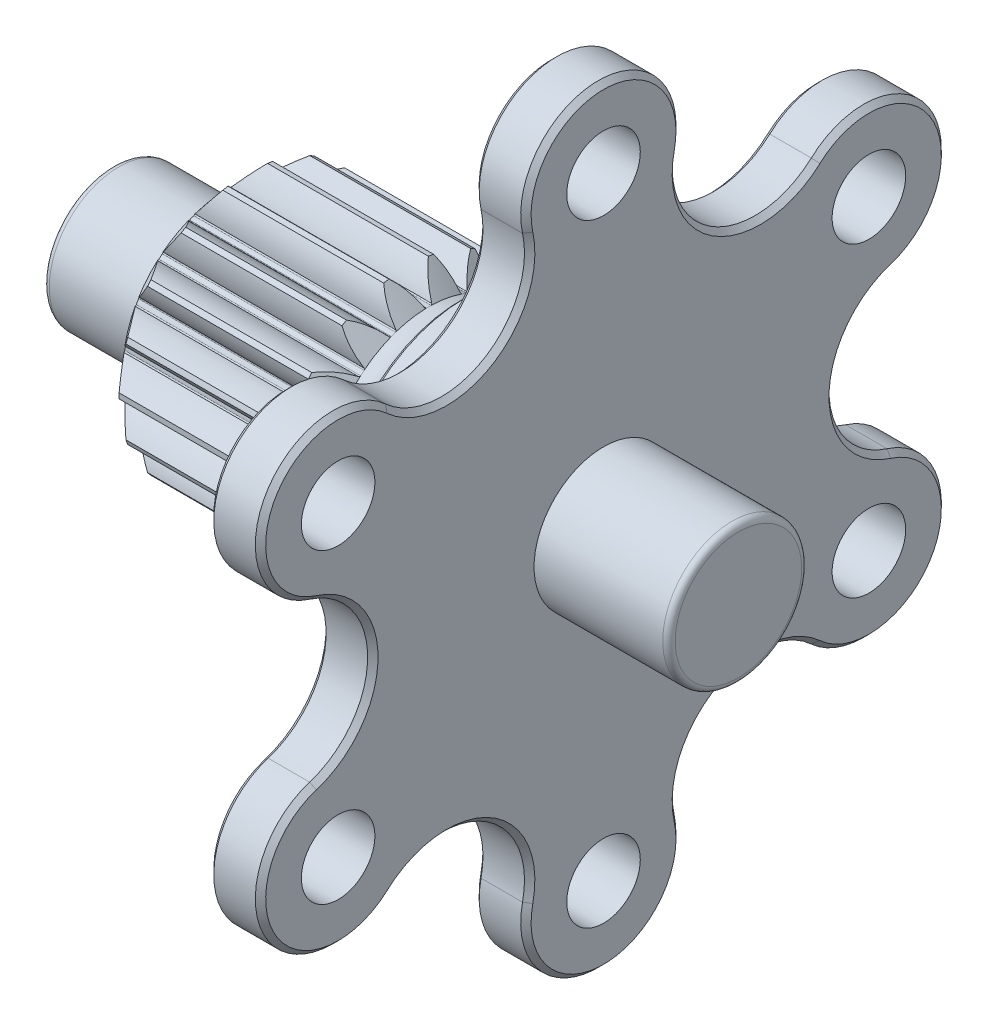
from build123d import *
from OCP.BRepFilletAPI import BRepFilletAPI_MakeChamfer

# Parameters (mm, degrees)
SKETCH1_R              = 47
BASE_EXTRUDE_DEPTH     = 6.35
M8_CLEARANCE_HOLES_D   = 9
CIRPATTERN_COUNT       = 6
CUT_EXTRUDE_DEPTH      = 67.770670957
CUT_EXTRUDE_DEPTH_BACK = 67.770670957
CHAMFER1_SIZE          = 0.635
SKETCH8_R              = 15.748
SHAFT_EXTRUDE_DEPTH    = 52.5820005
CHAMFER3_SIZE          = 0.635
SHAFT_CHAMFER_SIZE     = 1
CUT_EXTRUDE1_START     = -12.856999432
SKETCH45_R             = 15.748
SKETCH45_R_2           = 8.5127
CUT_EXTRUDE1_DEPTH     = 12.856999432
SKETCH55_R             = 8.5
BOSS_EXTRUDE4_DEPTH    = 16.51
SKETCH56_R             = 8.5127
BOSS_EXTRUDE5_DEPTH    = 1.143
FILLET9_R              = 1.524
CUT_EXTRUDE17_START    = -25.4
CUT_EXTRUDE17_DEPTH    = 25.4
CHAMFER6_SIZE          = 2.54
CHAMFER6_SIZE2         = 3.027054125
FILLET10_R             = 1.27
FILLET11_R             = 0.762
FILLET12_R             = 0.762
CHAMFER7_SIZE          = 0.508


with BuildPart() as part:
    # Sketch1 → Base-Extrude (new body)
    with BuildSketch(Plane(origin=(0, 0, 0), x_dir=(0, 0, -1), z_dir=(1, 0, 0))):
        Circle(SKETCH1_R)
    extrude(amount=-BASE_EXTRUDE_DEPTH)

    # M8 Clearance Holes (through all)
    with Locations(Plane(origin=(0, 0, 0), x_dir=(0, 0, -1), z_dir=(1, 0, 0))):
        with Locations((0, -37.5)):
            m8_clearance_holes = Hole(M8_CLEARANCE_HOLES_D / 2)

    # CirPattern: M8 Clearance Holes ×6 about axis
    cirpattern_axis = Axis((0, 0, 0), (1, 0, 0))
    for i in range(1, CIRPATTERN_COUNT):
        add(m8_clearance_holes.rotate(cirpattern_axis, i * 360 / CIRPATTERN_COUNT), mode=Mode.SUBTRACT)

    # Sketch19 → Cut-Extrude (cut, two sides: drawn at the far end of the back side and taken through both)
    with BuildSketch(Plane(origin=(0, 0, 0), x_dir=(0, 0, -1), z_dir=(1, 0, 0)).offset(-CUT_EXTRUDE_DEPTH_BACK)):
        with BuildLine():
            ThreePointArc((9.274838239, 35.443941724), (14.114033661, 24.446223401), (26.057934823, 25.754216393))
            ThreePointArc((26.057934823, 25.754216393), (33.921184851, 28.139425108), (40.703194264, 23.499999504))
            ThreePointArc((40.703194264, 23.499999504), (23.500000227, 40.703193847), (-4.7e-08, 47))
            ThreePointArc((-4.7e-08, 47), (7.40886473, 43.446320157), (9.274838239, 35.443941724))
        make_face()
        with BuildLine():
            ThreePointArc((-26.057934823, 25.754216393), (-14.114033661, 24.446223401), (-9.274838239, 35.443941724))
            ThreePointArc((-9.274838239, 35.443941724), (-7.40886476, 43.44632012), (-4.7e-08, 47))
            ThreePointArc((-4.7e-08, 47), (-23.500000787, 40.703193523), (-40.703194863, 23.499998466))
            ThreePointArc((-40.703194863, 23.499998466), (-33.921185443, 28.139425017), (-26.057934823, 25.754216393))
        make_face()
        with BuildLine():
            ThreePointArc((40.703193464, -23.50000089), (47, -8e-07), (40.703194264, 23.499999504))
            ThreePointArc((40.703194264, 23.499999504), (41.33004921, 15.30689472), (35.332773062, 9.689725331))
            ThreePointArc((35.332773062, 9.689725331), (28.228067323, 0), (35.332773062, -9.689725331))
            ThreePointArc((35.332773062, -9.689725331), (41.330049499, -15.306895465), (40.703193464, -23.50000089))
        make_face()
        with BuildLine():
            ThreePointArc((-35.332773062, 9.689725331), (-41.330048992, 15.306894161), (-40.703194863, 23.499998466))
            ThreePointArc((-40.703194863, 23.499998466), (-47, -6.9e-08), (-40.703194794, -23.499998586))
            ThreePointArc((-40.703194794, -23.499998586), (-41.330049018, -15.306894226), (-35.332773062, -9.689725331))
            ThreePointArc((-35.332773062, -9.689725331), (-28.228067323, 0), (-35.332773062, 9.689725331))
        make_face()
        with BuildLine():
            ThreePointArc((-26.057934823, -25.754216393), (-33.921185375, -28.139425028), (-40.703194794, -23.499998586))
            ThreePointArc((-40.703194794, -23.499998586), (-23.500000688, -40.703193581), (4.4e-08, -47))
            ThreePointArc((4.4e-08, -47), (-7.408864732, -43.446320155), (-9.274838239, -35.443941724))
            ThreePointArc((-9.274838239, -35.443941724), (-14.114033661, -24.446223401), (-26.057934823, -25.754216393))
        make_face()
        with BuildLine():
            ThreePointArc((4.4e-08, -47), (23.499999574, -40.703194224), (40.703193464, -23.50000089))
            ThreePointArc((40.703193464, -23.50000089), (33.92118406, -28.13942523), (26.057934823, -25.754216393))
            ThreePointArc((26.057934823, -25.754216393), (14.114033661, -24.446223401), (9.274838239, -35.443941724))
            ThreePointArc((9.274838239, -35.443941724), (7.408864759, -43.446320121), (4.4e-08, -47))
        make_face()
    extrude(amount=CUT_EXTRUDE_DEPTH + CUT_EXTRUDE_DEPTH_BACK, mode=Mode.SUBTRACT)

    # Chamfer1
    chamfer1_edges = [part.edges().sort_by_distance(p)[0] for p in [
        (-6.35, -24.446223401, 14.114033661),
        (-6.35, 24.446223401, -14.114033661),
        (-6.35, 24.446223401, 14.114033661),
        (-6.35, 23.5, 40.703193978),
        (-6.35, 47, 0),
        (-6.35, -24.446223401, -14.114033661),
        (-6.35, -23.5, -40.703193978),
        (-6.35, -47, 0),
        (-6.35, 0, 28.228067323),
        (-6.35, -23.5, 40.703193978),
        (-6.35, 0, -28.228067323),
        (-6.35, 23.5, -40.703193978),
    ]]
    chamfer(chamfer1_edges, length=CHAMFER1_SIZE)

    # Sketch8 → Shaft-Extrude (add)
    with BuildSketch(Plane.ZY.offset(6.35)):
        with Locations(Location((0, 0, 0), (0, 0, 180))):
            Circle(SKETCH8_R)
    extrude(amount=SHAFT_EXTRUDE_DEPTH)

    # Chamfer3
    chamfer3_edges = [part.edges().sort_by_distance(p)[0] for p in [
        (0, 24.446223401, -14.114033661),
        (0, -24.446223401, 14.114033661),
        (0, -24.446223401, -14.114033661),
        (0, -47, 0),
        (0, -23.5, -40.703193978),
        (0, 24.446223401, 14.114033661),
        (0, 47, 0),
        (0, 23.5, 40.703193978),
        (0, 0, -28.228067323),
        (0, 23.5, -40.703193978),
        (0, 0, 28.228067323),
        (0, -23.5, 40.703193978),
    ]]
    chamfer(chamfer3_edges, length=CHAMFER3_SIZE)

    # Shaft Chamfer
    shaft_chamfer_edges = [part.edges().sort_by_distance(p)[0] for p in [
        (-58.9320005, 0, 15.748),
    ]]
    chamfer(shaft_chamfer_edges, length=SHAFT_CHAMFER_SIZE)

    # Sketch45 → Cut-Extrude1 (cut)
    with BuildSketch(Plane.ZY.offset(58.9320005).offset(CUT_EXTRUDE1_START)):
        with Locations(Location((0, 0, 0), (0, 0, 180))):
            Circle(SKETCH45_R)
        Circle(SKETCH45_R_2, mode=Mode.SUBTRACT)
    extrude(amount=CUT_EXTRUDE1_DEPTH, mode=Mode.SUBTRACT)

    # Sketch55 → Boss-Extrude4 (add)
    with BuildSketch(Plane(origin=(0, 0, 0), x_dir=(0, 0, -1), z_dir=(1, 0, 0))):
        Circle(SKETCH55_R)
    extrude(amount=BOSS_EXTRUDE4_DEPTH)

    # Sketch56 → Boss-Extrude5 (add)
    with BuildSketch(Plane.ZY.offset(58.9320005)):
        Circle(SKETCH56_R)
    extrude(amount=BOSS_EXTRUDE5_DEPTH)

    # Fillet9
    fillet9_edges = [part.edges().sort_by_distance(p)[0] for p in [
        (-46.075001068, 0, -8.5127),
    ]]
    fillet(fillet9_edges, radius=FILLET9_R)

    # Cut-Extrude17: read off the stored shape, not the designer's step
    # Cut-Extrude17 outline → Cut-Extrude17 (cut)
    with BuildSketch(Plane.ZY.offset(46.075001068).offset(CUT_EXTRUDE17_START)):
        with BuildLine():
            ThreePointArc((-14.684667578, 5.688588763), (-12.987779277, 6.048943991), (-11.254165829, 5.986733001))
            ThreePointArc((-11.254165829, 5.986733001), (-11.162537651, 6.019355375), (-11.090657474, 6.084877757))
            ThreePointArc((-11.090657474, 6.084877757), (-10.95542401, 6.325117018), (-10.814987438, 6.562352263))
            ThreePointArc((-10.814987438, 6.562352263), (-10.794183479, 6.657363514), (-10.811745764, 6.753027031))
            ThreePointArc((-10.811745764, 6.753027031), (-11.732428783, 8.223274824), (-12.268796147, 9.873000815))
            ThreePointArc((-12.268796147, 9.873000815), (-13.63816805, 7.874000015), (-14.684667578, 5.688588763))
        make_face()
        with BuildLine():
            ThreePointArc((-12.469388985, 2.647934833), (-13.837402385, 3.714623697), (-14.905662359, 5.081410594))
            ThreePointArc((-14.905662359, 5.081410594), (-15.508752491, 2.73461152), (-15.744685706, 0.323072774))
            ThreePointArc((-15.744685706, 0.323072774), (-14.273381038, 1.242065902), (-12.623039862, 1.776537414))
            ThreePointArc((-12.623039862, 1.776537414), (-12.548095048, 1.8385311), (-12.50295975, 1.924686467))
            ThreePointArc((-12.50295975, 1.924686467), (-12.458048528, 2.196690097), (-12.407220551, 2.467650443))
            ThreePointArc((-12.407220551, 2.467650443), (-12.420166986, 2.564047187), (-12.469388985, 2.647934833))
        make_face()
        with BuildLine():
            ThreePointArc((-8.152132052, 13.473761428), (-10.122619264, 12.063667902), (-11.853461818, 10.367976993))
            ThreePointArc((-11.853461818, 10.367976993), (-10.135659657, 10.126230162), (-8.527873304, 9.474840233))
            ThreePointArc((-8.527873304, 9.474840233), (-8.430613472, 9.474156555), (-8.340658225, 9.511142985))
            ThreePointArc((-8.340658225, 9.511142985), (-8.13141367, 9.690641477), (-7.918307228, 9.865537551))
            ThreePointArc((-7.918307228, 9.865537551), (-7.86626214, 9.947703548), (-7.850046439, 10.043604504))
            ThreePointArc((-7.850046439, 10.043604504), (-8.212351117, 11.740077645), (-8.152132052, 13.473761428))
        make_face()
        with BuildLine():
            ThreePointArc((-12.623039866, -1.776537385), (-14.273381041, -1.24206587), (-15.744685707, -0.323072738))
            ThreePointArc((-15.744685707, -0.323072738), (-15.508752498, -2.734611484), (-14.905662371, -5.08141056))
            ThreePointArc((-14.905662371, -5.08141056), (-13.837402393, -3.714623666), (-12.469388991, -2.647934805))
            ThreePointArc((-12.469388991, -2.647934805), (-12.420166992, -2.564047159), (-12.407220557, -2.467650415))
            ThreePointArc((-12.407220557, -2.467650415), (-12.458048533, -2.196690069), (-12.502959755, -1.924686439))
            ThreePointArc((-12.502959755, -1.924686439), (-12.548095052, -1.838531072), (-12.623039866, -1.776537385))
        make_face()
        with BuildLine():
            ThreePointArc((-3.052200518, 15.449387561), (-5.3861332, 14.798279398), (-7.592553624, 13.796834183))
            ThreePointArc((-7.592553624, 13.796834183), (-6.061029895, 12.982143528), (-4.7729934, 11.8201419))
            ThreePointArc((-4.7729934, 11.8201419), (-4.681832885, 11.786234631), (-4.5846525, 11.790224))
            ThreePointArc((-4.5846525, 11.790224), (-4.326634836, 11.887331556), (-4.066562304, 11.978793409))
            ThreePointArc((-4.066562304, 11.978793409), (-3.989553493, 12.038203723), (-3.941515659, 12.122775047))
            ThreePointArc((-3.941515659, 12.122775047), (-3.701742705, 13.840853836), (-3.052200518, 15.449387561))
        make_face()
        with BuildLine():
            ThreePointArc((-11.254165843, -5.986732975), (-12.987779291, -6.048943962), (-14.684667591, -5.68858873))
            ThreePointArc((-14.684667591, -5.68858873), (-13.638168068, -7.873999984), (-12.26879617, -9.873000787))
            ThreePointArc((-12.26879617, -9.873000787), (-11.732428801, -8.223274797), (-10.811745779, -6.753027006))
            ThreePointArc((-10.811745779, -6.753027006), (-10.794183495, -6.657363489), (-10.814987453, -6.562352239))
            ThreePointArc((-10.814987453, -6.562352239), (-10.955424024, -6.325116993), (-11.090657488, -6.084877731))
            ThreePointArc((-11.090657488, -6.084877731), (-11.162537665, -6.01935535), (-11.254165843, -5.986732975))
        make_face()
        with BuildLine():
            ThreePointArc((2.415871444, 15.561589545), (1.8e-08, 15.748), (-2.415871408, 15.561589551))
            ThreePointArc((-2.415871408, 15.561589551), (-1.255350476, 14.272218789), (-0.44242005, 12.739760007))
            ThreePointArc((-0.44242005, 12.739760007), (-0.368354156, 12.676718864), (-0.275670021, 12.647229995))
            ThreePointArc((-0.275670021, 12.647229995), (1.5e-08, 12.65023401), (0.27567005, 12.647229995))
            ThreePointArc((0.27567005, 12.647229995), (0.368354185, 12.676718863), (0.442420079, 12.739760006))
            ThreePointArc((0.442420079, 12.739760006), (1.255350509, 14.272218786), (2.415871444, 15.561589545))
        make_face()
        with BuildLine():
            ThreePointArc((-8.527873325, -9.474840214), (-10.135659679, -10.126230139), (-11.853461841, -10.367976966))
            ThreePointArc((-11.853461841, -10.367976966), (-10.122619291, -12.063667879), (-8.152132082, -13.473761409))
            ThreePointArc((-8.152132082, -13.473761409), (-8.212351144, -11.740077626), (-7.850046462, -10.043604486))
            ThreePointArc((-7.850046462, -10.043604486), (-7.866262163, -9.94770353), (-7.91830725, -9.865537533))
            ThreePointArc((-7.91830725, -9.865537533), (-8.131413692, -9.690641459), (-8.340658247, -9.511142966))
            ThreePointArc((-8.340658247, -9.511142966), (-8.430613493, -9.474156536), (-8.527873325, -9.474840214))
        make_face()
        with BuildLine():
            ThreePointArc((7.592553655, 13.796834166), (5.386133234, 14.798279386), (3.052200553, 15.449387554))
            ThreePointArc((3.052200553, 15.449387554), (3.701742737, 13.840853828), (3.941515687, 12.122775038))
            ThreePointArc((3.941515687, 12.122775038), (3.98955352, 12.038203713), (4.066562331, 11.9787934))
            ThreePointArc((4.066562331, 11.9787934), (4.326634863, 11.887331546), (4.584652527, 11.79022399))
            ThreePointArc((4.584652527, 11.79022399), (4.681832912, 11.78623462), (4.772993427, 11.820141889))
            ThreePointArc((4.772993427, 11.820141889), (6.061029924, 12.982143514), (7.592553655, 13.796834166))
        make_face()
        with BuildLine():
            ThreePointArc((-4.772993427, -11.820141889), (-6.061029924, -12.982143514), (-7.592553655, -13.796834166))
            ThreePointArc((-7.592553655, -13.796834166), (-5.386133234, -14.798279386), (-3.052200553, -15.449387554))
            ThreePointArc((-3.052200553, -15.449387554), (-3.701742737, -13.840853828), (-3.941515687, -12.122775038))
            ThreePointArc((-3.941515687, -12.122775038), (-3.98955352, -12.038203713), (-4.066562331, -11.9787934))
            ThreePointArc((-4.066562331, -11.9787934), (-4.326634863, -11.887331546), (-4.584652527, -11.79022399))
            ThreePointArc((-4.584652527, -11.79022399), (-4.681832912, -11.78623462), (-4.772993427, -11.820141889))
        make_face()
        with BuildLine():
            ThreePointArc((11.853461841, 10.367976966), (10.122619291, 12.063667879), (8.152132082, 13.473761409))
            ThreePointArc((8.152132082, 13.473761409), (8.212351144, 11.740077626), (7.850046462, 10.043604486))
            ThreePointArc((7.850046462, 10.043604486), (7.866262163, 9.94770353), (7.91830725, 9.865537533))
            ThreePointArc((7.91830725, 9.865537533), (8.131413692, 9.690641459), (8.340658247, 9.511142966))
            ThreePointArc((8.340658247, 9.511142966), (8.430613493, 9.474156536), (8.527873325, 9.474840214))
            ThreePointArc((8.527873325, 9.474840214), (10.135659679, 10.126230139), (11.853461841, 10.367976966))
        make_face()
        with BuildLine():
            ThreePointArc((-0.442420079, -12.739760006), (-1.255350509, -14.272218786), (-2.415871444, -15.561589545))
            ThreePointArc((-2.415871444, -15.561589545), (-1.8e-08, -15.748), (2.415871408, -15.561589551))
            ThreePointArc((2.415871408, -15.561589551), (1.255350476, -14.272218789), (0.44242005, -12.739760007))
            ThreePointArc((0.44242005, -12.739760007), (0.368354156, -12.676718864), (0.275670021, -12.647229995))
            ThreePointArc((0.275670021, -12.647229995), (-1.5e-08, -12.65023401), (-0.27567005, -12.647229995))
            ThreePointArc((-0.27567005, -12.647229995), (-0.368354185, -12.676718863), (-0.442420079, -12.739760006))
        make_face()
        with BuildLine():
            ThreePointArc((14.684667591, 5.68858873), (13.638168068, 7.873999984), (12.26879617, 9.873000787))
            ThreePointArc((12.26879617, 9.873000787), (11.732428801, 8.223274797), (10.811745779, 6.753027006))
            ThreePointArc((10.811745779, 6.753027006), (10.794183495, 6.657363489), (10.814987453, 6.562352239))
            ThreePointArc((10.814987453, 6.562352239), (10.955424024, 6.325116993), (11.090657488, 6.084877731))
            ThreePointArc((11.090657488, 6.084877731), (11.162537665, 6.01935535), (11.254165843, 5.986732975))
            ThreePointArc((11.254165843, 5.986732975), (12.987779291, 6.048943962), (14.684667591, 5.68858873))
        make_face()
        with BuildLine():
            ThreePointArc((3.941515659, -12.122775047), (3.701742705, -13.840853836), (3.052200518, -15.449387561))
            ThreePointArc((3.052200518, -15.449387561), (5.3861332, -14.798279398), (7.592553624, -13.796834183))
            ThreePointArc((7.592553624, -13.796834183), (6.061029895, -12.982143528), (4.7729934, -11.8201419))
            ThreePointArc((4.7729934, -11.8201419), (4.681832885, -11.786234631), (4.5846525, -11.790224))
            ThreePointArc((4.5846525, -11.790224), (4.326634836, -11.887331556), (4.066562304, -11.978793409))
            ThreePointArc((4.066562304, -11.978793409), (3.989553493, -12.038203723), (3.941515659, -12.122775047))
        make_face()
        with BuildLine():
            ThreePointArc((15.744685707, 0.323072738), (15.508752498, 2.734611484), (14.905662371, 5.08141056))
            ThreePointArc((14.905662371, 5.08141056), (13.837402393, 3.714623666), (12.469388991, 2.647934805))
            ThreePointArc((12.469388991, 2.647934805), (12.420166992, 2.564047159), (12.407220557, 2.467650415))
            ThreePointArc((12.407220557, 2.467650415), (12.458048533, 2.196690069), (12.502959755, 1.924686439))
            ThreePointArc((12.502959755, 1.924686439), (12.548095052, 1.838531072), (12.623039866, 1.776537385))
            ThreePointArc((12.623039866, 1.776537385), (14.273381041, 1.24206587), (15.744685707, 0.323072738))
        make_face()
        with BuildLine():
            ThreePointArc((7.850046439, -10.043604504), (8.212351117, -11.740077645), (8.152132052, -13.473761428))
            ThreePointArc((8.152132052, -13.473761428), (10.122619264, -12.063667902), (11.853461818, -10.367976993))
            ThreePointArc((11.853461818, -10.367976993), (10.135659657, -10.126230162), (8.527873304, -9.474840233))
            ThreePointArc((8.527873304, -9.474840233), (8.430613472, -9.474156555), (8.340658225, -9.511142985))
            ThreePointArc((8.340658225, -9.511142985), (8.13141367, -9.690641477), (7.918307228, -9.865537551))
            ThreePointArc((7.918307228, -9.865537551), (7.86626214, -9.947703548), (7.850046439, -10.043604504))
        make_face()
        with BuildLine():
            ThreePointArc((14.905662359, -5.081410594), (15.508752491, -2.73461152), (15.744685706, -0.323072774))
            ThreePointArc((15.744685706, -0.323072774), (14.273381038, -1.242065902), (12.623039862, -1.776537414))
            ThreePointArc((12.623039862, -1.776537414), (12.548095048, -1.8385311), (12.50295975, -1.924686467))
            ThreePointArc((12.50295975, -1.924686467), (12.458048528, -2.196690097), (12.407220551, -2.467650443))
            ThreePointArc((12.407220551, -2.467650443), (12.420166986, -2.564047187), (12.469388985, -2.647934833))
            ThreePointArc((12.469388985, -2.647934833), (13.837402385, -3.714623697), (14.905662359, -5.081410594))
        make_face()
        with BuildLine():
            ThreePointArc((10.811745764, -6.753027031), (11.732428783, -8.223274824), (12.268796147, -9.873000815))
            ThreePointArc((12.268796147, -9.873000815), (13.63816805, -7.874000015), (14.684667578, -5.688588763))
            ThreePointArc((14.684667578, -5.688588763), (12.987779277, -6.048943991), (11.254165829, -5.986733001))
            ThreePointArc((11.254165829, -5.986733001), (11.162537651, -6.019355375), (11.090657474, -6.084877757))
            ThreePointArc((11.090657474, -6.084877757), (10.95542401, -6.325117018), (10.814987438, -6.562352263))
            ThreePointArc((10.814987438, -6.562352263), (10.794183479, -6.657363514), (10.811745764, -6.753027031))
        make_face()
    extrude(amount=CUT_EXTRUDE17_DEPTH, mode=Mode.SUBTRACT)

    # Sketch94 → Cut-Revolve2 (revolve, cut)
    with BuildSketch(Plane.XY, mode=Mode.PRIVATE) as cut_revolve2_sk:
        with BuildLine():
            Line((-21.383096822, 12.652967625), (-23.850001068, 15.748))
            Line((-23.850001068, 15.748), (-17.500001068, 15.748))
            ThreePointArc((-17.500001068, 15.748), (-18.429937038, 13.50293597), (-20.675001068, 12.573))
            ThreePointArc((-20.675001068, 12.573), (-21.031299545, 12.593055247), (-21.383096822, 12.652967625))
        make_face()
    revolve(cut_revolve2_sk.sketch.rotate(Axis((-47.599001068, 0, 0), (-1, 0, 0)), 90), axis=Axis((-47.599001068, 0, 0), (-1, 0, 0)), mode=Mode.SUBTRACT)

    # Chamfer6: one chamfer whose edges measure the first distance from different faces: ONE call of the kernel's chamfer builder (chamfer() names one face for all edges)
    chamfer6_edges_1 = [part.edges().sort_by_distance(p)[0] for p in [
        (-46.075001068, 15.508752498, -2.734611484),
    ]]
    chamfer6_side_1 = [part.faces().sort_by_distance(p)[0] for p in [
        (-34.962501068, 15.508752498, -2.734611484),
    ]]
    chamfer6_edges_2 = [part.edges().sort_by_distance(p)[0] for p in [
        (-46.075001068, 13.638168068, -7.873999985),
    ]]
    chamfer6_side_2 = [part.faces().sort_by_distance(p)[0] for p in [
        (-34.962501068, 13.638168068, -7.873999985),
    ]]
    chamfer6_edges_3 = [part.edges().sort_by_distance(p)[0] for p in [
        (-46.075001068, 10.122619291, -12.063667879),
    ]]
    chamfer6_side_3 = [part.faces().sort_by_distance(p)[0] for p in [
        (-34.962501068, 10.122619291, -12.063667879),
    ]]
    chamfer6_edges_4 = [part.edges().sort_by_distance(p)[0] for p in [
        (-46.075001068, 5.386133234, -14.798279386),
    ]]
    chamfer6_side_4 = [part.faces().sort_by_distance(p)[0] for p in [
        (-34.962501068, 5.386133234, -14.798279386),
    ]]
    chamfer6_edges_5 = [part.edges().sort_by_distance(p)[0] for p in [
        (-46.075001068, 1.8e-08, -15.748),
    ]]
    chamfer6_side_5 = [part.faces().sort_by_distance(p)[0] for p in [
        (-34.962501068, 1.8e-08, -15.748),
    ]]
    chamfer6_edges_6 = [part.edges().sort_by_distance(p)[0] for p in [
        (-46.075001068, -5.3861332, -14.798279398),
    ]]
    chamfer6_side_6 = [part.faces().sort_by_distance(p)[0] for p in [
        (-34.962501068, -5.3861332, -14.798279398),
    ]]
    chamfer6_edges_7 = [part.edges().sort_by_distance(p)[0] for p in [
        (-46.075001068, -10.122619263, -12.063667902),
    ]]
    chamfer6_side_7 = [part.faces().sort_by_distance(p)[0] for p in [
        (-34.962501068, -10.122619263, -12.063667902),
    ]]
    chamfer6_edges_8 = [part.edges().sort_by_distance(p)[0] for p in [
        (-46.075001068, -13.63816805, -7.874000015),
    ]]
    chamfer6_side_8 = [part.faces().sort_by_distance(p)[0] for p in [
        (-34.962501068, -13.63816805, -7.874000015),
    ]]
    chamfer6_edges_9 = [part.edges().sort_by_distance(p)[0] for p in [
        (-46.075001068, -15.508752491, -2.73461152),
    ]]
    chamfer6_side_9 = [part.faces().sort_by_distance(p)[0] for p in [
        (-34.962501068, -15.508752491, -2.73461152),
    ]]
    chamfer6_edges_10 = [part.edges().sort_by_distance(p)[0] for p in [
        (-46.075001068, -15.508752498, 2.734611484),
    ]]
    chamfer6_side_10 = [part.faces().sort_by_distance(p)[0] for p in [
        (-34.962501068, -15.508752498, 2.734611484),
    ]]
    chamfer6_edges_11 = [part.edges().sort_by_distance(p)[0] for p in [
        (-46.075001068, -13.638168068, 7.873999985),
    ]]
    chamfer6_side_11 = [part.faces().sort_by_distance(p)[0] for p in [
        (-34.962501068, -13.638168068, 7.873999985),
    ]]
    chamfer6_edges_12 = [part.edges().sort_by_distance(p)[0] for p in [
        (-46.075001068, -10.122619291, 12.063667879),
    ]]
    chamfer6_side_12 = [part.faces().sort_by_distance(p)[0] for p in [
        (-34.962501068, -10.122619291, 12.063667879),
    ]]
    chamfer6_edges_13 = [part.edges().sort_by_distance(p)[0] for p in [
        (-46.075001068, -5.386133234, 14.798279386),
    ]]
    chamfer6_side_13 = [part.faces().sort_by_distance(p)[0] for p in [
        (-34.962501068, -5.386133234, 14.798279386),
    ]]
    chamfer6_edges_14 = [part.edges().sort_by_distance(p)[0] for p in [
        (-46.075001068, -1.8e-08, 15.748),
    ]]
    chamfer6_side_14 = [part.faces().sort_by_distance(p)[0] for p in [
        (-34.962501068, -1.8e-08, 15.748),
    ]]
    chamfer6_edges_15 = [part.edges().sort_by_distance(p)[0] for p in [
        (-46.075001068, 5.3861332, 14.798279398),
    ]]
    chamfer6_side_15 = [part.faces().sort_by_distance(p)[0] for p in [
        (-34.962501068, 5.3861332, 14.798279398),
    ]]
    chamfer6_edges_16 = [part.edges().sort_by_distance(p)[0] for p in [
        (-46.075001068, 10.122619263, 12.063667902),
    ]]
    chamfer6_side_16 = [part.faces().sort_by_distance(p)[0] for p in [
        (-34.962501068, 10.122619263, 12.063667902),
    ]]
    chamfer6_edges_17 = [part.edges().sort_by_distance(p)[0] for p in [
        (-46.075001068, 13.63816805, 7.874000015),
    ]]
    chamfer6_side_17 = [part.faces().sort_by_distance(p)[0] for p in [
        (-34.962501068, 13.63816805, 7.874000015),
    ]]
    chamfer6_edges_18 = [part.edges().sort_by_distance(p)[0] for p in [
        (-46.075001068, 15.508752491, 2.73461152),
    ]]
    chamfer6_side_18 = [part.faces().sort_by_distance(p)[0] for p in [
        (-34.962501068, 15.508752491, 2.73461152),
    ]]
    chamfer6 = BRepFilletAPI_MakeChamfer(part.part.solid().wrapped)
    for e in chamfer6_edges_1:
        chamfer6.Add(CHAMFER6_SIZE, CHAMFER6_SIZE2, e.wrapped, chamfer6_side_1[0].wrapped)  # the first distance lies on this face
    for e in chamfer6_edges_2:
        chamfer6.Add(CHAMFER6_SIZE, CHAMFER6_SIZE2, e.wrapped, chamfer6_side_2[0].wrapped)  # the first distance lies on this face
    for e in chamfer6_edges_3:
        chamfer6.Add(CHAMFER6_SIZE, CHAMFER6_SIZE2, e.wrapped, chamfer6_side_3[0].wrapped)  # the first distance lies on this face
    for e in chamfer6_edges_4:
        chamfer6.Add(CHAMFER6_SIZE, CHAMFER6_SIZE2, e.wrapped, chamfer6_side_4[0].wrapped)  # the first distance lies on this face
    for e in chamfer6_edges_5:
        chamfer6.Add(CHAMFER6_SIZE, CHAMFER6_SIZE2, e.wrapped, chamfer6_side_5[0].wrapped)  # the first distance lies on this face
    for e in chamfer6_edges_6:
        chamfer6.Add(CHAMFER6_SIZE, CHAMFER6_SIZE2, e.wrapped, chamfer6_side_6[0].wrapped)  # the first distance lies on this face
    for e in chamfer6_edges_7:
        chamfer6.Add(CHAMFER6_SIZE, CHAMFER6_SIZE2, e.wrapped, chamfer6_side_7[0].wrapped)  # the first distance lies on this face
    for e in chamfer6_edges_8:
        chamfer6.Add(CHAMFER6_SIZE, CHAMFER6_SIZE2, e.wrapped, chamfer6_side_8[0].wrapped)  # the first distance lies on this face
    for e in chamfer6_edges_9:
        chamfer6.Add(CHAMFER6_SIZE, CHAMFER6_SIZE2, e.wrapped, chamfer6_side_9[0].wrapped)  # the first distance lies on this face
    for e in chamfer6_edges_10:
        chamfer6.Add(CHAMFER6_SIZE, CHAMFER6_SIZE2, e.wrapped, chamfer6_side_10[0].wrapped)  # the first distance lies on this face
    for e in chamfer6_edges_11:
        chamfer6.Add(CHAMFER6_SIZE, CHAMFER6_SIZE2, e.wrapped, chamfer6_side_11[0].wrapped)  # the first distance lies on this face
    for e in chamfer6_edges_12:
        chamfer6.Add(CHAMFER6_SIZE, CHAMFER6_SIZE2, e.wrapped, chamfer6_side_12[0].wrapped)  # the first distance lies on this face
    for e in chamfer6_edges_13:
        chamfer6.Add(CHAMFER6_SIZE, CHAMFER6_SIZE2, e.wrapped, chamfer6_side_13[0].wrapped)  # the first distance lies on this face
    for e in chamfer6_edges_14:
        chamfer6.Add(CHAMFER6_SIZE, CHAMFER6_SIZE2, e.wrapped, chamfer6_side_14[0].wrapped)  # the first distance lies on this face
    for e in chamfer6_edges_15:
        chamfer6.Add(CHAMFER6_SIZE, CHAMFER6_SIZE2, e.wrapped, chamfer6_side_15[0].wrapped)  # the first distance lies on this face
    for e in chamfer6_edges_16:
        chamfer6.Add(CHAMFER6_SIZE, CHAMFER6_SIZE2, e.wrapped, chamfer6_side_16[0].wrapped)  # the first distance lies on this face
    for e in chamfer6_edges_17:
        chamfer6.Add(CHAMFER6_SIZE, CHAMFER6_SIZE2, e.wrapped, chamfer6_side_17[0].wrapped)  # the first distance lies on this face
    for e in chamfer6_edges_18:
        chamfer6.Add(CHAMFER6_SIZE, CHAMFER6_SIZE2, e.wrapped, chamfer6_side_18[0].wrapped)  # the first distance lies on this face
    add(Compound.cast(chamfer6.Shape()), mode=Mode.REPLACE)

    # Fillet10
    fillet10_edges = [part.edges().sort_by_distance(p)[0] for p in [
        (-6.35, 0, 15.748),
    ]]
    fillet(fillet10_edges, radius=FILLET10_R)

    # Fillet11
    fillet11_edges = [part.edges().sort_by_distance(p)[0] for p in [
        (-60.0750005, 0, -8.5127),
    ]]
    fillet(fillet11_edges, radius=FILLET11_R)

    # Fillet12
    fillet12_edges = [part.edges().sort_by_distance(p)[0] for p in [
        (16.51, 0, 8.5),
    ]]
    fillet(fillet12_edges, radius=FILLET12_R)

    # Chamfer7
    # the kernel refuses this chamfer: 0.508 mm, written as the material it takes off along each edge
    with BuildSketch(Plane(origin=(-17.500001068, 0, 0), x_dir=(0, 0, -1), z_dir=(0, 1, 0))) as chamfer7_piece_1:
        with BuildLine():
            Line((15.748, -CHAMFER7_SIZE), (15.190708024, 0.049291976))
            ThreePointArc((15.190708024, 0.049291976), (15.460461722, 0.013047006), (15.748, 0))
            Line((15.748, 0), (15.748, -CHAMFER7_SIZE))
        make_face()
    revolve(axis=Axis((-17.500001068, 0, 0), (-1, 0, 0)), mode=Mode.SUBTRACT)


solid = part.part
